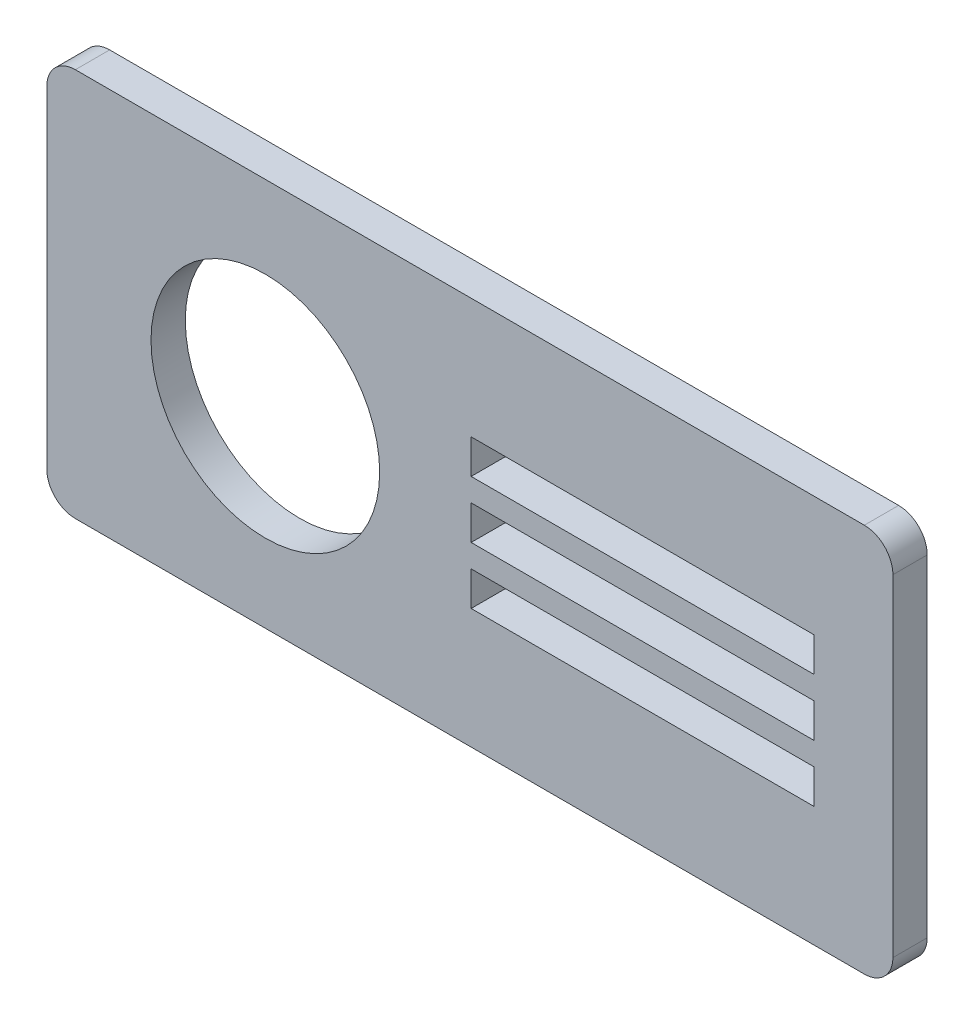
from build123d import *

# Parameters (mm, degrees)
SKETCH1_R           = 10
SKETCH1_W           = 30
SKETCH1_H           = 3
BOSS_EXTRUDE1_DEPTH = 3


with BuildPart() as part:
    # Sketch1 → Boss-Extrude1 (new body)
    with BuildSketch(Plane.XY):
        with BuildLine():
            Line((-150, 98.203720637), (-150, 69.203720637))
            ThreePointArc((-150, 69.203720637), (-149.267766953, 67.435953684), (-147.5, 66.703720637))
            Line((-147.5, 66.703720637), (-78.5, 66.703720637))
            ThreePointArc((-78.5, 66.703720637), (-76.732233047, 67.435953684), (-76, 69.203720637))
            Line((-76, 69.203720637), (-76, 98.203720637))
            ThreePointArc((-76, 98.203720637), (-76.732233047, 99.97148759), (-78.5, 100.703720637))
            Line((-78.5, 100.703720637), (-147.5, 100.703720637))
            ThreePointArc((-147.5, 100.703720637), (-149.267766953, 99.97148759), (-150, 98.203720637))
        make_face()
        with Locations((-130.886316496, 83.527802162)):
            Circle(SKETCH1_R, mode=Mode.SUBTRACT)
        with Locations((-97.886316496, 83.703720637)):
            Rectangle(SKETCH1_W, SKETCH1_H, mode=Mode.SUBTRACT)
        with Locations((-97.886316496, 88.703720637)):
            Rectangle(SKETCH1_W, SKETCH1_H, mode=Mode.SUBTRACT)
        with Locations((-97.886316496, 78.703720637)):
            Rectangle(SKETCH1_W, SKETCH1_H, mode=Mode.SUBTRACT)
    extrude(amount=-BOSS_EXTRUDE1_DEPTH)


solid = part.part
